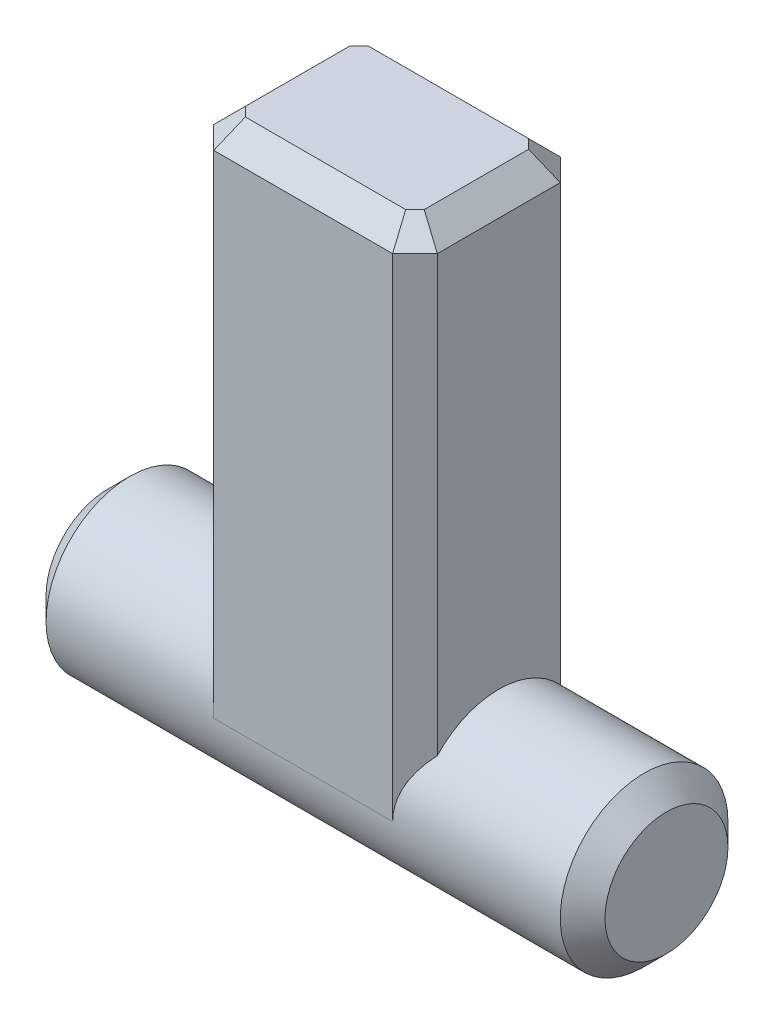
from build123d import *

# Parameters (mm, degrees)
SKETCH_1_R               = 49.99999999999999
EXTRUDE_1_DEPTH          = 50
CUT_EXTRUDE_2_DEPTH      = 87.60254037844385
CUT_EXTRUDE_3_DEPTH      = 76.00000000000004
FILLET_1_R               = 2
CHAMFER_1_SIZE           = 0.6
SHELL_1_T                = -1.2
EXTRUDE_2_DEPTH          = 2
EXTRUDE_2_DEPTH_BACK     = 2
SKETCH_4_R               = 1.500000000000004
SKETCH_5_R               = 1.500000000000004
EXTRUDE_3_DEPTH          = 3
CUT_EXTRUDE_4_DEPTH      = 75.75240590513992
CUT_EXTRUDE_4_DEPTH_BACK = 75.75240590513992
SKETCH_7_W               = 4
SKETCH_7_H               = 3.000000000000007
EXTRUDE_4_DEPTH          = 3
SKETCH_8_W               = 61.68253403520822
SKETCH_8_H               = 49.35584928772633
CUT_EXTRUDE_5_DEPTH      = 75.75240590513992
SKETCH_9_W               = 4
SKETCH_9_H               = 3.000000000000007
EXTRUDE_5_DEPTH          = 6.2
CHAMFER_2_SIZE           = 0.4
CHAMFER_3_SIZE           = 0.4
CHAMFER_4_SIZE           = 0.4


with BuildPart() as part:
    # 草图1 → 凸台-拉伸1 (new body)
    with BuildSketch(Plane(origin=(0, 0, 0), x_dir=(1, 0, 0), z_dir=(0, 1, 0))):
        with Locations(Location((0, 0, 0), (0, 0, 270))):
            Circle(SKETCH_1_R)
    extrude(amount=EXTRUDE_1_DEPTH)

    # 草图2 → 切除-拉伸2 (cut, through all)
    with BuildSketch(Plane(origin=(0, 50, 0), x_dir=(1, 0, 0), z_dir=(0, 1, 0))):
        with BuildLine():
            Line((-24.999999999999993, -43.301270189221945), (-7.11e-15, -1.421e-14))
            Line((7.11e-15, -1.421e-14), (25.00000000000002, -43.301270189221924))
            ThreePointArc((25.00000000000002, -43.301270189221924), (2.487e-14, 50), (-25.000000000000053, -43.30127018922191))
        make_face()
    extrude(amount=-CUT_EXTRUDE_2_DEPTH, mode=Mode.SUBTRACT)

    # 草图3 → 切除-拉伸3 (cut, through all)
    with BuildSketch(Plane(origin=(0, 50, 0), x_dir=(1, 0, 0), z_dir=(0, 1, 0))):
        with BuildLine():
            ThreePointArc((-7.5000000000002185, -12.990381056766447), (-3.882285676537599, -14.488887394336077), (6.9403e-13, -14.999999999999996))
            ThreePointArc((6.9403e-13, -14.999999999999996), (3.8822856765382965, -14.488887394335892), (7.500000000000258, -12.990381056766429))
            Line((7.5, -12.990381056766573), (0, 0))
            Line((4.01e-15, 0), (-7.499999999999988, -12.990381056766578))
        make_face()
        with BuildLine():
            ThreePointArc((15, 0), (-7.499999999999881, 12.99038105676664), (-7.5000000000002185, -12.990381056766447))
            Line((-7.499999999999988, -12.990381056766578), (4.01e-15, 0))
            Line((0, 0), (7.5, -12.990381056766573))
            ThreePointArc((7.500000000000258, -12.990381056766429), (12.99038105676665, -7.499999999999878), (15, -3.67e-15))
        make_face()
        with BuildLine():
            ThreePointArc((7.500000000000258, -12.990381056766429), (3.8822856765382965, -14.488887394335892), (6.9403e-13, -14.999999999999996))
            Line((6.9456e-13, -15), (8.660254037844409, -15))
            Line((8.660254037844393, -15.000000000000004), (7.5, -12.990381056766573))
        make_face()
        with BuildLine():
            Line((-7.499999999999988, -12.990381056766578), (-8.660254037844377, -15.000000000000002))
            Line((-8.660254037844384, -15), (6.9456e-13, -15))
            ThreePointArc((6.9403e-13, -14.999999999999996), (-3.882285676537599, -14.488887394336077), (-7.5000000000002185, -12.990381056766447))
        make_face()
    extrude(amount=-CUT_EXTRUDE_3_DEPTH, mode=Mode.SUBTRACT)

    # 圆角1
    fillet_1_edges = [part.edges().sort_by_distance(p)[0] for p in [
        (25.00000000000002, 25, 43.301270189221924),
        (-25.00000000000002, 25, 43.301270189221924),
        (-8.66025403784438, 25, 15),
        (8.6602540378444, 25, 15.000000000000002),
    ]]
    fillet(fillet_1_edges, radius=FILLET_1_R)

    # 倒角1
    chamfer_1_edges = [part.edges().sort_by_distance(p)[0] for p in [
        (8.79e-15, 0, 15),
        (-16.608380961798794, -7.11e-15, 28.766559657295183),
        (16.60838096179882, 0, 28.766559657295183),
        (2.132e-14, 0, 50),
        (8.505553499465146, 0, 15.267949192431121),
        (24.16775252630995, 0, 43.09090065934718),
        (-24.16775252630992, 0, 43.09090065934719),
        (-8.505553499465128, 0, 15.267949192431121),
    ]]
    chamfer(chamfer_1_edges, length=CHAMFER_1_SIZE)

    # 抽壳1
    shell_1_openings = [part.faces().sort_by_distance(p)[0] for p in [
        (0, 50, 34.229276229),
    ]]
    offset(amount=SHELL_1_T, openings=shell_1_openings)

    # 草图4 → 凸台-拉伸2 (add, two sides: drawn at the far end of the back side and taken through both)
    with BuildSketch(Plane(origin=(0, 0, 0), x_dir=(0, 0, -1), z_dir=(1, 0, 0)).offset(-EXTRUDE_2_DEPTH_BACK)):
        with BuildLine():
            Line((-44.5, 0), (-44.5, -3))
            ThreePointArc((-44.50000000000001, -3), (-43, -1.499999999999996), (-41.49999999999999, -3))
            Line((-41.49999999999999, -3), (-41.49999999999999, 0))
            Line((-41.49999999999999, 0), (-44.5, 0))
        make_face()
        with Locations((-43, -3)):
            Circle(SKETCH_4_R)
    extrude(amount=EXTRUDE_2_DEPTH + EXTRUDE_2_DEPTH_BACK)

    # 草图5 → 凸台-拉伸3 (add)
    with BuildSketch(Plane(origin=(2, 0, 0), x_dir=(0, 0, -1), z_dir=(1, 0, 0))):
        with Locations((-43, -3)):
            Circle(SKETCH_5_R)
    extrude_3 = extrude(amount=EXTRUDE_3_DEPTH)

    # 镜向1: 凸台-拉伸3 across plane
    add(extrude_3.mirror(Plane(origin=(0, 0, 0), x_dir=(0, 0, 1), z_dir=(1, 0, 0))))

    # 草图6 → 切除-拉伸4 (cut, two sides: drawn at the far end of the back side and taken through both)
    with BuildSketch(Plane(origin=(0, 0, 0), x_dir=(0, 0, -1), z_dir=(1, 0, 0)).offset(-CUT_EXTRUDE_4_DEPTH_BACK)):
        with BuildLine():
            ThreePointArc((-41.533119314589705, 49.97969668707788), (-27.73588672288851, 47.754377602956666), (-15.000000000000043, 42.000000000000036))
            Line((-15, 42.00000000000006), (-15, 50))
            Line((-15, 50), (-16, 50))
            Line((-16, 50), (-41.53311931459036, 50))
            Line((-41.53311931459036, 50), (-41.53311931459036, 49.97969668707786))
        make_face()
    extrude(amount=CUT_EXTRUDE_4_DEPTH + CUT_EXTRUDE_4_DEPTH_BACK, mode=Mode.SUBTRACT)

    # 草图7 → 凸台-拉伸4 (add)
    with BuildSketch(Plane(origin=(0, 1.2, 0), x_dir=(1, 0, 0), z_dir=(0, 1, 0))):
        Polygon((-3.1999999999999997, -40.3), (3.1999999999999997, -40.3), (3.2000000000000006, -45.699999999999996), (-3.199999999999999, -45.699999999999996), align=None)
        with Locations((0, -43)):
            Rectangle(SKETCH_7_W, SKETCH_7_H, mode=Mode.SUBTRACT)
    extrude(amount=EXTRUDE_4_DEPTH)

    # 草图8 → 切除-拉伸5 (cut, through all)
    with BuildSketch(Plane.XZ):
        with Locations((0.9928928322647028, 29.450924327847446)):
            Rectangle(SKETCH_8_W, SKETCH_8_H)
    extrude(amount=-CUT_EXTRUDE_5_DEPTH, mode=Mode.SUBTRACT)

    # 草图9 → 凸台-拉伸5 (add)
    with BuildSketch(Plane(origin=(0, 0, 0), x_dir=(1, 0, 0), z_dir=(0, 1, 0))):
        with Locations((0, -43)):
            Rectangle(SKETCH_9_W, SKETCH_9_H)
    extrude(amount=EXTRUDE_5_DEPTH)

    # 倒角2
    # the kernel refuses this chamfer: 0.4 mm, written as the material it takes off along each edge
    with BuildSketch(Plane(origin=(2, 0, 44.5), x_dir=(-0.999621916911297, 0, 0.027495876610578732), z_dir=(0, 1, 0))) as chamfer_2_piece_1:
        Polygon((CHAMFER_2_SIZE * 0.999621916911, -CHAMFER_2_SIZE * 0.0274958766106), (-CHAMFER_2_SIZE * 0.0274958766106, -CHAMFER_2_SIZE * 0.999621916911), (0, 0), align=None)
    extrude(amount=7.228673195186364, mode=Mode.SUBTRACT)
    with BuildSketch(Plane(origin=(-2, 0, 41.49999999999999), x_dir=(-0.027495876610586577, 0, 0.9996219169112966), z_dir=(0, 1, 0))) as chamfer_2_piece_2:
        Polygon((CHAMFER_2_SIZE * 0.999621916911, CHAMFER_2_SIZE * 0.0274958766106), (-CHAMFER_2_SIZE * 0.0274958766106, CHAMFER_2_SIZE * 0.999621916911), (0, 0), align=None)
    extrude(amount=7.228673195186364, mode=Mode.SUBTRACT)
    with BuildSketch(Plane(origin=(-2, 0, 44.5), x_dir=(-0.027495876610586577, 0, -0.9996219169112966), z_dir=(0, 1, 0))) as chamfer_2_piece_3:
        Polygon((CHAMFER_2_SIZE * 0.999621916911, -CHAMFER_2_SIZE * 0.0274958766106), (-CHAMFER_2_SIZE * 0.0274958766106, -CHAMFER_2_SIZE * 0.999621916911), (0, 0), align=None)
    extrude(amount=7.228673195186364, mode=Mode.SUBTRACT)
    with BuildSketch(Plane(origin=(2, 0, 41.49999999999999), x_dir=(-0.999621916911297, 0, -0.027495876610578732), z_dir=(0, 1, 0))) as chamfer_2_piece_4:
        Polygon((CHAMFER_2_SIZE * 0.999621916911, CHAMFER_2_SIZE * 0.0274958766106), (-CHAMFER_2_SIZE * 0.0274958766106, CHAMFER_2_SIZE * 0.999621916911), (0, 0), align=None)
    extrude(amount=7.228673195186364, mode=Mode.SUBTRACT)
    with BuildSketch(Plane(origin=(2, -4.0286731951863635, 41.49999999999999), x_dir=(-0.999621916911297, 0, -0.027495876610578732), z_dir=(0, 1, 0))) as chamfer_2_piece_5_section:
        Polygon((CHAMFER_2_SIZE * 0.999621916911, CHAMFER_2_SIZE * 0.0274958766106), (-CHAMFER_2_SIZE * 0.0274958766106, CHAMFER_2_SIZE * 0.999621916911), (0, 0), align=None)
    chamfer_2_piece_5 = extrude(amount=4.0286731951863635, mode=Mode.PRIVATE)
    chamfer_2_piece_5 = chamfer_2_piece_5 - Plane(origin=(1.8624054064801094, -3, 43), x_dir=(0, 0, -1), z_dir=(-1, 0, 0)) * Cylinder(1.500000000000004, 10, mode=Mode.PRIVATE)
    add(chamfer_2_piece_5, mode=Mode.SUBTRACT)
    with BuildSketch(Plane(origin=(-2, 0, 44.5), x_dir=(-0.027495876610586577, 0, -0.9996219169112966), z_dir=(0, -1, 0))) as chamfer_2_piece_6_section:
        Polygon((CHAMFER_2_SIZE * 0.999621916911, CHAMFER_2_SIZE * 0.0274958766106), (-CHAMFER_2_SIZE * 0.0274958766106, CHAMFER_2_SIZE * 0.999621916911), (0, 0), align=None)
    chamfer_2_piece_6 = extrude(amount=4.028673195186364, mode=Mode.PRIVATE)
    chamfer_2_piece_6 = chamfer_2_piece_6 - Plane(origin=(-1.8624054062772368, -3, 43), x_dir=(0, 0, -1), z_dir=(1, 0, 0)) * Cylinder(1.500000000000004, 10, mode=Mode.PRIVATE)
    add(chamfer_2_piece_6, mode=Mode.SUBTRACT)
    with BuildSketch(Plane(origin=(-2, -4.0286731951863635, 41.49999999999999), x_dir=(-0.027495876610586577, 0, 0.9996219169112966), z_dir=(0, 1, 0))) as chamfer_2_piece_7_section:
        Polygon((CHAMFER_2_SIZE * 0.999621916911, CHAMFER_2_SIZE * 0.0274958766106), (-CHAMFER_2_SIZE * 0.0274958766106, CHAMFER_2_SIZE * 0.999621916911), (0, 0), align=None)
    chamfer_2_piece_7 = extrude(amount=4.0286731951863635, mode=Mode.PRIVATE)
    chamfer_2_piece_7 = chamfer_2_piece_7 - Plane(origin=(-1.8624054064801103, -3, 43), x_dir=(0, 0, -1), z_dir=(1, 0, 0)) * Cylinder(1.500000000000004, 10, mode=Mode.PRIVATE)
    add(chamfer_2_piece_7, mode=Mode.SUBTRACT)
    with BuildSketch(Plane(origin=(2, 0, 44.5), x_dir=(-0.999621916911297, 0, 0.027495876610578732), z_dir=(0, -1, 0))) as chamfer_2_piece_8_section:
        Polygon((CHAMFER_2_SIZE * 0.999621916911, CHAMFER_2_SIZE * 0.0274958766106), (-CHAMFER_2_SIZE * 0.0274958766106, CHAMFER_2_SIZE * 0.999621916911), (0, 0), align=None)
    chamfer_2_piece_8 = extrude(amount=4.028673195186364, mode=Mode.PRIVATE)
    chamfer_2_piece_8 = chamfer_2_piece_8 - Plane(origin=(1.8624054062774078, -3, 43), x_dir=(0, 0, -1), z_dir=(-1, 0, 0)) * Cylinder(1.500000000000004, 10, mode=Mode.PRIVATE)
    add(chamfer_2_piece_8, mode=Mode.SUBTRACT)

    # 倒角3
    chamfer_3_edges = [part.edges().sort_by_distance(p)[0] for p in [
        (0, 6.2, 44.5),
        (-2, 6.2, 43),
        (2, 6.2, 43),
        (0, 6.2, 41.49999999999999),
        (1.8000000000000584, 6.2, 41.69999999999994),
        (-1.8000000000000587, 6.2, 41.699999999999946),
        (-1.8000000000000587, 6.2, 44.300000000000054),
        (1.800000000000062, 6.2, 44.30000000000006),
    ]]
    chamfer(chamfer_3_edges, length=CHAMFER_3_SIZE)

    # 倒角4
    chamfer_4_edges = [part.edges().sort_by_distance(p)[0] for p in [
        (5, -3, 44.50000000000001),
        (-5, -3, 44.50000000000001),
    ]]
    chamfer(chamfer_4_edges, length=CHAMFER_4_SIZE)


solid = part.part
